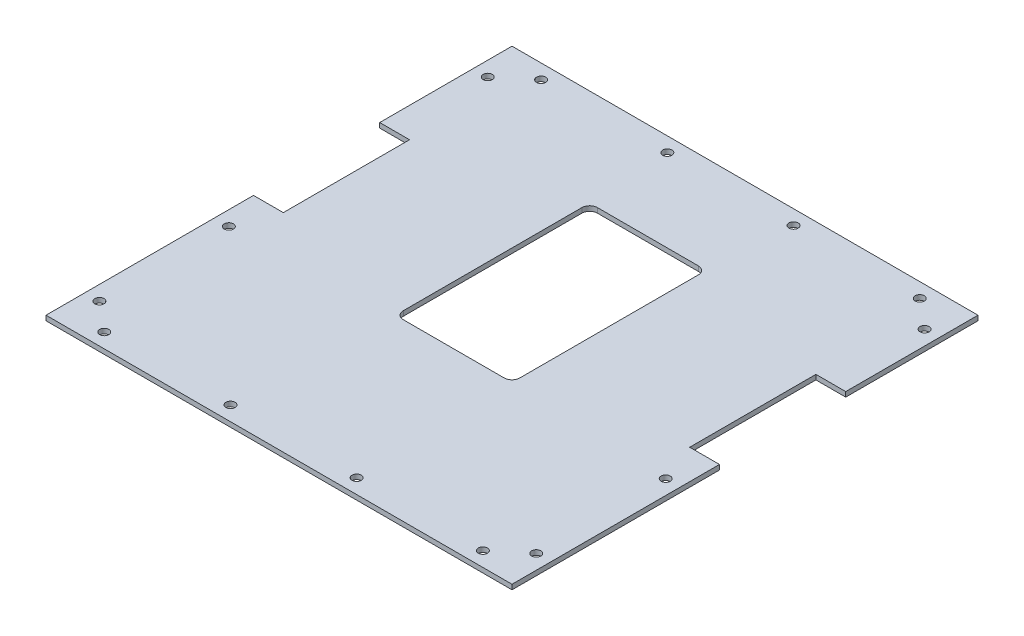
from build123d import *

# Parameters (mm, degrees)
SKETCH2_W             = 152.4
SKETCH2_H             = 152.4
BOSS_EXTRUDE1_DEPTH   = 1.5875
F_3_0MM_DOWEL_HOLE1_D = 3
F_3_0MM_DOWEL_HOLE2_D = 3
LPATTERN1_COUNT       = 4
LPATTERN1_PITCH       = 42.333333333
LPATTERN2_COUNT       = 4
LPATTERN2_PITCH       = 41.275
SKETCH12_W            = 38.1
SKETCH12_H            = 63.5
CUT_EXTRUDE1_DEPTH    = 2.54
FILLET2_R             = 2.54
SKETCH13_W            = 9.75
SKETCH13_H            = 41.28
CUT_EXTRUDE2_DEPTH    = 216.531993347


with BuildPart() as part:
    # Sketch2 → Boss-Extrude1 (new body)
    with BuildSketch(Plane(origin=(0, 0, 0), x_dir=(1, 0, 0), z_dir=(0, 1, 0))):
        with Locations((76.2, 76.2)):
            Rectangle(SKETCH2_W, SKETCH2_H)
    extrude(amount=BOSS_EXTRUDE1_DEPTH)

    # Ø3.0mm Dowel Hole1 (through all)
    with Locations(Plane(origin=(0, 1.5875, 0), x_dir=(1, 0, 0), z_dir=(0, 1, 0))):
        with Locations((14.2875, 147.6375), (14.2875, 4.7625)):
            f_3_0mm_dowel_hole1 = Hole(F_3_0MM_DOWEL_HOLE1_D / 2)

    # Ø3.0mm Dowel Hole2 (through all)
    with Locations(Plane(origin=(0, 1.5875, 0), x_dir=(1, 0, 0), z_dir=(0, 1, 0))):
        with Locations((4.7625, 139.7), (147.6375, 139.7)):
            f_3_0mm_dowel_hole2 = Hole(F_3_0MM_DOWEL_HOLE2_D / 2)

    # LPattern1: Ø3.0mm Dowel Hole2 ×4, 1 skipped
    with Locations(*[(0, 0, i * LPATTERN1_PITCH) for i in range(1, LPATTERN1_COUNT) if i not in (1,)]):
        add(f_3_0mm_dowel_hole2, mode=Mode.SUBTRACT)

    # LPattern2: Ø3.0mm Dowel Hole1 ×4
    with Locations(*[(i * LPATTERN2_PITCH, 0, 0) for i in range(1, LPATTERN2_COUNT)]):
        add(f_3_0mm_dowel_hole1, mode=Mode.SUBTRACT)

    # Sketch12 → Cut-Extrude1 (cut)
    with BuildSketch(Plane(origin=(0, 1.5875, 0), x_dir=(1, 0, 0), z_dir=(0, 1, 0))):
        with Locations((76.2, 88.9)):
            Rectangle(SKETCH12_W, SKETCH12_H)
    extrude(amount=-CUT_EXTRUDE1_DEPTH, mode=Mode.SUBTRACT)

    # Fillet2
    fillet2_edges = [part.edges().sort_by_distance(p)[0] for p in [
        (95.25, 0.79375, -57.15),
        (57.15, 0.79375, -57.15),
        (57.15, 0.79375, -120.65),
        (95.25, 0.79375, -120.65),
    ]]
    fillet(fillet2_edges, radius=FILLET2_R)

    # Sketch13 → Cut-Extrude2 (cut, through all)
    with BuildSketch(Plane(origin=(0, 1.5875, 0), x_dir=(1, 0, 0), z_dir=(0, 1, 0))):
        with Locations((147.525, 88.5)):
            Rectangle(SKETCH13_W, SKETCH13_H)
        with Locations((4.875, 88.5)):
            Rectangle(SKETCH13_W, SKETCH13_H)
    extrude(amount=-CUT_EXTRUDE2_DEPTH, mode=Mode.SUBTRACT)


solid = part.part
